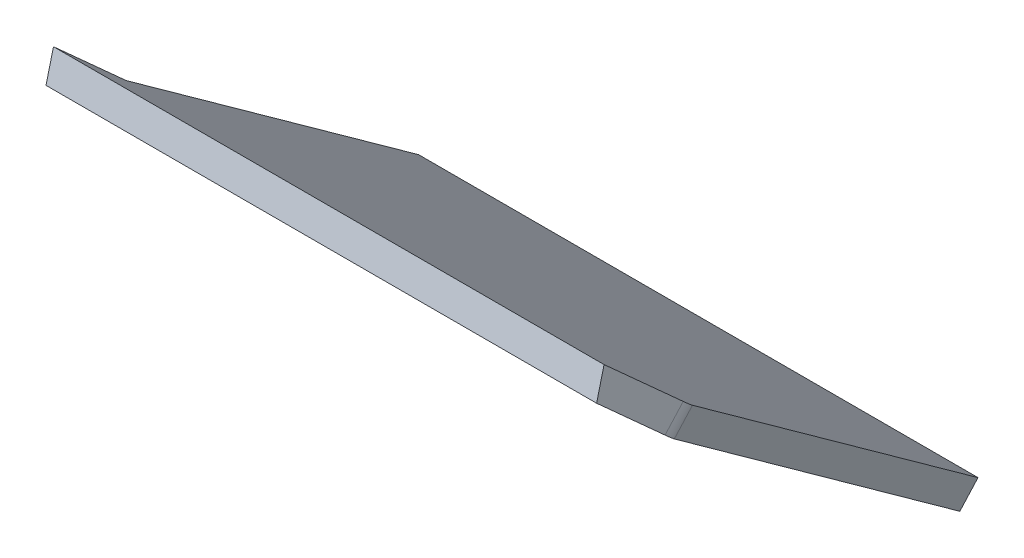
from build123d import *

# Parameters (mm, degrees)
BASE_FLANGE1_DEPTH     = 1.9
CUT_EXTRUDE4_DEPTH     = 51
CUT_EXTRUDE5_DEPTH     = 71
CUT_EXTRUDE6_START     = 657.08317619
CUT_EXTRUDE6_OUTLINE_W = 45
CUT_EXTRUDE6_OUTLINE_H = 5
CUT_EXTRUDE6_DEPTH     = 6.384307163


# Read off the part's stored shape, not the designer's step: Cut-Extrude6
# Sheet-metal steps are written as plain solids
with BuildPart() as part:
    # Sketch2 → Base-Flange1 (new body)
    with BuildSketch(Plane(origin=(0, 12.879518456, -11.630211804), x_dir=(1, 0, 0), z_dir=(0, 0.7421858097500026, -0.6701941687345042))):
        with BuildLine():
            Line((393.586333182, -753.894678625), (393.586333182, -742.759749552))
            ThreePointArc((393.586333182, -742.759749552), (393.512573412, -742.109852512), (393.295046173, -741.493014958))
            Line((393.295046173, -741.493014958), (348.107032655, -648.432828145))
            Line((348.107032655, -648.432828145), (308.882727398, -648.432828145))
            Line((308.882727398, -648.432828145), (354.876732599, -743.152874081))
            ThreePointArc((354.876732599, -743.152874081), (354.951741991, -743.365576685), (354.977176395, -743.589679113))
            Line((354.977176395, -743.589679113), (354.977176395, -753.894678625))
            Line((354.977176395, -753.894678625), (393.586333182, -753.894678625))
        make_face()
    extrude(amount=BASE_FLANGE1_DEPTH)

    # Sketch7 → Cut-Extrude4 (cut)
    with BuildSketch(Plane(origin=(393.586333182, 0, 0), x_dir=(0, 0, -1), z_dir=(1, 0, 0))):
        Polygon((-546.842488726, 505.418101773), (-542.81093091, 521.489711401), (-552.083782305, 523.815803023), align=None)
    extrude(amount=-CUT_EXTRUDE4_DEPTH, mode=Mode.SUBTRACT)

    # Sketch8 → Cut-Extrude5 (cut)
    with BuildSketch(Plane(origin=(367.203150583, 992.710115794, 1099.346123122), x_dir=(0, 0.9994421284849351, 0.03339808092544755), z_dir=(-1, 0, 0))):
        Polygon((-558.189174553, 593.766016484), (-559.014569405, 618.466070053), (-566.956297266, 616.781727113), (-568.023912054, 608.400656093), align=None)
    extrude(amount=CUT_EXTRUDE5_DEPTH, mode=Mode.SUBTRACT)

    # Cut-Extrude6 outline → Cut-Extrude6 (cut)
    with BuildSketch(Plane(origin=(0, 0, 0), x_dir=(1, 0, 0), z_dir=(0, 0.6701941687345039, 0.7421858097500029)).offset(CUT_EXTRUDE6_START)):
        with Locations((334.5, 18.5)):
            Rectangle(CUT_EXTRUDE6_OUTLINE_W, CUT_EXTRUDE6_OUTLINE_H)
    extrude(amount=CUT_EXTRUDE6_DEPTH, mode=Mode.SUBTRACT)


solid = part.part
